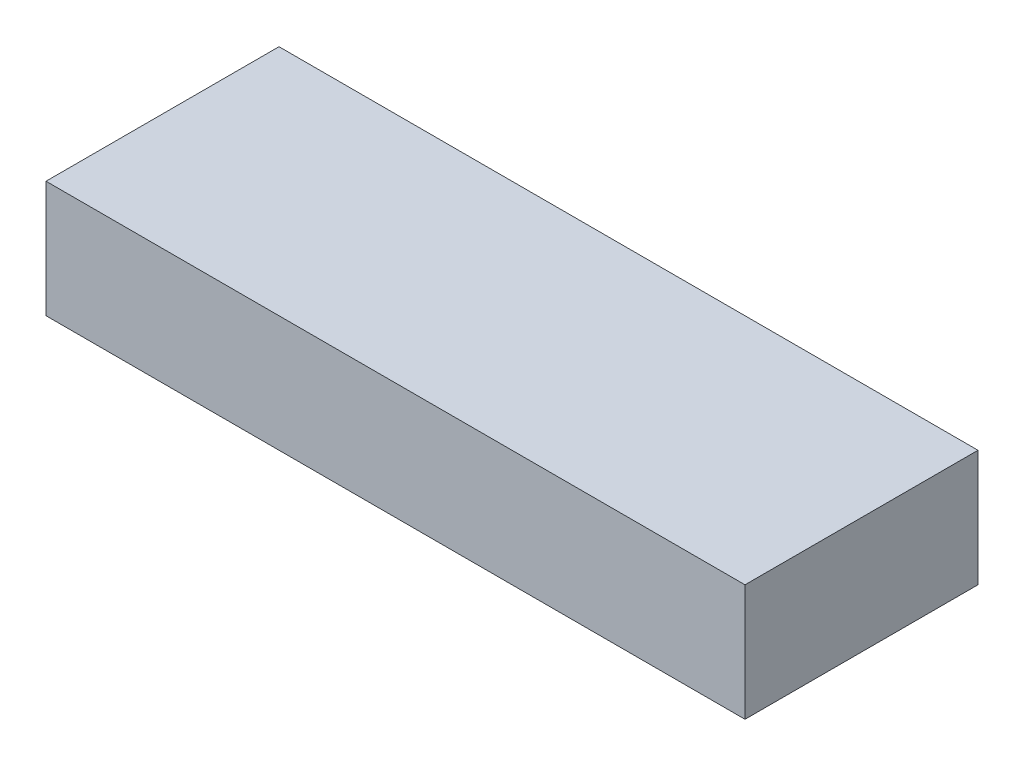
from build123d import *

# Parameters (mm, degrees)
SKETCH1_W           = 38.1
SKETCH1_H           = 12.7
BOSS_EXTRUDE1_DEPTH = 6.35
BOSS_EXTRUDE2_START = -0.508
BOSS_EXTRUDE2_DEPTH = 0.508


# Read off the part's stored shape, not the designer's step: Boss-Extrude2
with BuildPart() as part:
    # Sketch1 → Boss-Extrude1 (new body)
    with BuildSketch(Plane(origin=(0, 0, 0), x_dir=(1, 0, 0), z_dir=(0, 1, 0))):
        Rectangle(SKETCH1_W, SKETCH1_H)
    extrude(amount=BOSS_EXTRUDE1_DEPTH)


with BuildPart() as body_2:
    # Boss-Extrude2 outline → Boss-Extrude2 (new body)
    with BuildSketch(Plane(origin=(0, 6.35, 0), x_dir=(1, 0, 0), z_dir=(0, 1, 0)).offset(BOSS_EXTRUDE2_START)):
        with BuildLine():
            add(Edge.make_bspline(
                [(-1.911312881, -3.328169001), (-1.914155064, -3.327814447), (-1.924894218, -3.326474765), (-1.948199317, -3.318597457), (-1.988318743, -3.311811233), (-2.020185877, -3.304508432), (-2.038749808, -3.300254246)],
                knots=[0, 0, 0, 0, 0.065761094, 0.248477555, 0.56220691, 1, 1, 1, 1], degree=3))
            Line((-1.911312881, -3.328169001), (-1.930731842, -3.442255393))
            Line((-1.930731842, -3.442255393), (-1.310538799, -3.442255393))
            add(Edge.make_bspline(
                [(-0.59203727, -3.407058527), (-0.600059544, -3.410149267), (-0.621899223, -3.418563435), (-0.666035058, -3.42358605), (-0.728209595, -3.43001628), (-0.808862776, -3.434231568), (-0.907965619, -3.437983867), (-1.025326217, -3.439758583), (-1.161644788, -3.443026953), (-1.258752091, -3.442523748), (-1.310538799, -3.442255393)],
                knots=[0, 0, 0, 0, 0.035664115, 0.097091268, 0.183340579, 0.296308639, 0.432732696, 0.596027477, 0.784564016, 1, 1, 1, 1], degree=3))
            add(Edge.make_bspline(
                [(-0.448822438, -3.305108986), (-0.465709, -3.31779737), (-0.496058255, -3.340601478), (-0.537724756, -3.369001585), (-0.567635137, -3.391655766), (-0.585107586, -3.402684473), (-0.59203727, -3.407058527)],
                knots=[0, 0, 0, 0, 0.360325825, 0.64759305, 0.860233186, 1, 1, 1, 1], degree=3))
            Line((-0.448822438, -3.305108986), (-0.044665328, -2.966490867))
            add(Edge.make_bspline(
                [(0.198071675, -2.727394919), (0.195721894, -2.731094664), (0.188753582, -2.742066313), (0.171190379, -2.7604242), (0.145511219, -2.787672442), (0.098723157, -2.834004555), (0.034862288, -2.895193278), (-0.018645181, -2.943163452), (-0.044665328, -2.966490867)],
                knots=[0, 0, 0, 0, 0.03847759, 0.114105856, 0.222295526, 0.368186332, 0.692755341, 1, 1, 1, 1], degree=3))
            Line((0.198071675, -2.727394919), (0.256328556, -2.637582228))
            Line((0.256328556, -2.637582228), (0.409252868, -2.419118925))
            add(Edge.make_bspline(
                [(0.459013953, -2.347511509), (0.452539489, -2.3568154), (0.435936814, -2.380673664), (0.419363293, -2.404552191), (0.409252868, -2.419118925)],
                knots=[0, 0, 0, 0, 0.389965147, 1, 1, 1, 1], degree=3))
            add(Edge.make_bspline(
                [(0.490569764, -2.284399888), (0.483068252, -2.295424502), (0.469696827, -2.315075845), (0.462272954, -2.337616432), (0.459013953, -2.347511509)],
                knots=[0, 0, 0, 0, 0.561010681, 1, 1, 1, 1], degree=3))
            add(Edge.make_bspline(
                [(0.57188666, -2.170313497), (0.563509781, -2.184150666), (0.548330787, -2.209223763), (0.526335588, -2.241865687), (0.508796777, -2.267219999), (0.49599476, -2.279286553), (0.490569764, -2.284399888)],
                knots=[0, 0, 0, 0, 0.345107442, 0.625338361, 0.841233008, 1, 1, 1, 1], degree=3))
            Line((0.57188666, -2.170313497), (0.659271981, -2.01132076))
            Line((0.659271981, -2.01132076), (0.823119458, -1.737027946))
            add(Edge.make_bspline(
                [(1.031873281, -1.807421677), (1.01277457, -1.802431867), (0.974726312, -1.792491218), (0.92043813, -1.773220994), (0.868490137, -1.75865184), (0.837532496, -1.743897273), (0.823119458, -1.737027946)],
                knots=[0, 0, 0, 0, 0.268283473, 0.534471612, 0.783262603, 1, 1, 1, 1], degree=3))
            add(Edge.make_bspline(
                [(1.649638953, -2.069577641), (1.63816085, -2.059523639), (1.611620834, -2.036276473), (1.559607188, -2.006170611), (1.493202259, -1.97181656), (1.382521809, -1.921689428), (1.227461473, -1.863838963), (1.09767695, -1.826402703), (1.031873281, -1.807421677)],
                knots=[0, 0, 0, 0, 0.06765367, 0.15643085, 0.265752781, 0.400065773, 0.695819866, 1, 1, 1, 1], degree=3))
            add(Edge.make_bspline(
                [(1.921504397, -2.195800882), (1.907319474, -2.19560297), (1.882129047, -2.195251507), (1.849182319, -2.192205811), (1.824748032, -2.186116348), (1.80679678, -2.171816972), (1.788630835, -2.153832321), (1.761922538, -2.149685403), (1.736008486, -2.142356052), (1.711406439, -2.125409212), (1.682081183, -2.100386325), (1.661273449, -2.080626311), (1.649638953, -2.069577641)],
                knots=[0, 0, 0, 0, 0.136862362, 0.243048293, 0.320929747, 0.374094605, 0.463228005, 0.560946958, 0.626469684, 0.723008888, 0.845122395, 1, 1, 1, 1], degree=3))
            add(Edge.make_bspline(
                [(3.626731843, -2.4373242), (3.570062739, -2.437137336), (3.468806273, -2.436803446), (3.334591666, -2.428436853), (3.233087692, -2.421636221), (3.158089932, -2.404384401), (3.094458397, -2.388501867), (3.029415775, -2.379317427), (2.960795423, -2.374560054), (2.889256774, -2.367655962), (2.811414755, -2.362232215), (2.726769792, -2.352827801), (2.640958041, -2.340167304), (2.560606237, -2.324989881), (2.487107527, -2.310155223), (2.419822436, -2.296478725), (2.361040944, -2.287814204), (2.310262732, -2.284568576), (2.261070832, -2.28051317), (2.208496278, -2.265712742), (2.151758744, -2.249454392), (2.095316059, -2.233265627), (2.041800378, -2.22103277), (1.994713415, -2.206941695), (1.955013876, -2.197835662), (1.931241608, -2.19639215), (1.921504397, -2.195800882)],
                knots=[0, 0, 0, 0, 0.098367376, 0.17576302, 0.233645837, 0.274569138, 0.309165833, 0.347517732, 0.388416904, 0.428616166, 0.47231583, 0.523909207, 0.576469332, 0.622906931, 0.665894873, 0.706679237, 0.742149438, 0.768929498, 0.7950754, 0.827621098, 0.863423711, 0.897683498, 0.929547174, 0.958692517, 0.983080297, 1, 1, 1, 1], degree=3))
            Line((3.626731843, -2.4373242), (4.060017394, -2.4373242))
            Line((4.060017394, -2.4373242), (4.272412271, -2.223715638))
            Line((4.272412271, -2.223715638), (4.272412271, -1.337725576))
            add(Edge.make_bspline(
                [(4.16318062, -0.343717549), (4.177088549, -0.346689906), (4.207437154, -0.353175911), (4.236777515, -0.401930883), (4.255905523, -0.468523138), (4.261369272, -0.54230439), (4.264011605, -0.615955353), (4.266895117, -0.685557951), (4.267171352, -0.766903027), (4.270488971, -0.859111195), (4.271504958, -0.963099525), (4.270739513, -1.078000547), (4.272889999, -1.204216151), (4.272575854, -1.292009378), (4.272412271, -1.337725576)],
                knots=[0, 0, 0, 0, 0.039669652, 0.086563474, 0.152933145, 0.242523667, 0.298845081, 0.366881537, 0.444265225, 0.534566279, 0.634222548, 0.745595376, 0.867524951, 1, 1, 1, 1], degree=3))
            add(Edge.make_bspline(
                [(4.130411125, -0.270896448), (4.137782086, -0.283673696), (4.150195523, -0.305191863), (4.155759264, -0.323923536), (4.169296809, -0.344202528), (4.164087607, -0.343789468), (4.16318062, -0.343717549)],
                knots=[0, 0, 0, 0, 0.494572505, 0.832909654, 0.9709075, 1, 1, 1, 1], degree=3))
            add(Edge.make_bspline(
                [(3.527209672, 0.243705999), (3.551817089, 0.232587381), (3.606331831, 0.207955434), (3.687786694, 0.152666893), (3.779272276, 0.082099823), (3.873158975, -0.002930521), (3.961604995, -0.088534544), (4.036584412, -0.162854171), (4.091558242, -0.221040641), (4.119260216, -0.256587663), (4.130411125, -0.270896448)],
                knots=[0, 0, 0, 0, 0.101269179, 0.224349558, 0.368425874, 0.535259843, 0.699695807, 0.830789481, 0.931887492, 1, 1, 1, 1], degree=3))
            add(Edge.make_bspline(
                [(3.249275804, 0.457314561), (3.261134367, 0.451042325), (3.282175669, 0.439913152), (3.317334875, 0.437592939), (3.35497001, 0.427197516), (3.392845097, 0.396717742), (3.43153778, 0.357760907), (3.471407554, 0.323230098), (3.499684876, 0.284448954), (3.5199252, 0.269487063), (3.522563438, 0.238616895), (3.526794548, 0.243251305), (3.527209672, 0.243705999)],
                knots=[0, 0, 0, 0, 0.10875251, 0.19296557, 0.286632661, 0.425060799, 0.585065268, 0.737962698, 0.865318115, 0.952055214, 0.99529602, 1, 1, 1, 1], degree=3))
            add(Edge.make_bspline(
                [(2.841477638, 0.587178858), (2.880064956, 0.579319223), (2.954285236, 0.564201708), (3.059902785, 0.531897857), (3.156592421, 0.494655137), (3.218964543, 0.469526459), (3.249275804, 0.457314561)],
                knots=[0, 0, 0, 0, 0.275341564, 0.529602184, 0.771398654, 1, 1, 1, 1], degree=3))
            add(Edge.make_bspline(
                [(2.739528097, 0.616307298), (2.758367192, 0.609202194), (2.791570262, 0.596679762), (2.826406946, 0.590047877), (2.841477638, 0.587178858)],
                knots=[0, 0, 0, 0, 0.567390138, 1, 1, 1, 1], degree=3))
            Line((2.739528097, 0.616307298), (2.471303709, 0.697624194))
            add(Edge.make_bspline(
                [(2.115212588, 0.829323945), (2.13635194, 0.822367474), (2.177602522, 0.806019847), (2.235559824, 0.78088922), (2.286193493, 0.755275005), (2.329386016, 0.737702159), (2.362844397, 0.724917796), (2.391998137, 0.717783135), (2.426828458, 0.709070251), (2.453912689, 0.70209991), (2.471303709, 0.697624194)],
                knots=[0.289278138, 0.289278138, 0.289278138, 0.289278138, 0.413859299, 0.537651587, 0.643071538, 0.731452513, 0.798830854, 0.843354204, 0.899416372, 1, 1, 1, 1], degree=3))
            add(Edge.make_bspline(
                [(2.95313666, 1.303253017), (2.917534795, 1.274396738), (2.843213138, 1.214157017), (2.743219998, 1.147307234), (2.661098889, 1.097808701), (2.604242512, 1.067774598), (2.554073543, 1.043347391), (2.505292595, 1.027328104), (2.452660527, 1.01020161), (2.393175638, 0.980443687), (2.319252223, 0.946283465), (2.23985593, 0.901889189), (2.170246083, 0.86217136), (2.129052141, 0.837752418), (2.115212588, 0.829323945)],
                knots=[0, 0, 0, 0, 0.126305349, 0.263672219, 0.33120238, 0.390585186, 0.440991932, 0.484737994, 0.532011081, 0.59340289, 0.667739231, 0.756586152, 0.844028485, 0.88870161, 0.88870161, 0.88870161, 0.88870161], degree=3))
            add(Edge.make_bspline(
                [(3.073291476, 1.403988873), (3.076948048, 1.405779475), (3.082689185, 1.408590878), (3.07549389, 1.399037508), (3.064165088, 1.393079567), (3.03708793, 1.370244226), (2.998448721, 1.342261056), (2.968000873, 1.316049252), (2.95313666, 1.303253017)],
                knots=[0, 0, 0, 0, 0.044662039, 0.070123319, 0.150638955, 0.301765688, 0.659131779, 1, 1, 1, 1], degree=3))
            add(Edge.make_bspline(
                [(3.300250574, 1.53385317), (3.284842994, 1.525009533), (3.249756948, 1.504870859), (3.194282887, 1.471122443), (3.135290479, 1.43437456), (3.093287725, 1.413789027), (3.073291476, 1.403988873)],
                knots=[0, 0, 0, 0, 0.203718473, 0.463906448, 0.744781966, 1, 1, 1, 1], degree=3))
            add(Edge.make_bspline(
                [(3.458029626, 1.646725876), (3.444738944, 1.635323666), (3.418115073, 1.612482779), (3.377823469, 1.580148263), (3.338974524, 1.552730619), (3.312139118, 1.539648689), (3.300250574, 1.53385317)],
                knots=[0, 0, 0, 0, 0.269825528, 0.540514039, 0.796439856, 1, 1, 1, 1], degree=3))
            Line((3.458029626, 1.646725876), (3.570902333, 1.771735433))
            Line((3.570902333, 1.771735433), (3.553910742, 3.075233139))
            Line((3.553910742, 3.075233139), (3.238352638, 3.459971289))
            Line((3.238352638, 3.459971289), (2.790502868, 3.459971289))
            add(Edge.make_bspline(
                [(1.949419152, 3.275491167), (1.984666064, 3.295620323), (2.053617776, 3.33499795), (2.155963334, 3.378760836), (2.243568784, 3.40795895), (2.308023733, 3.420931189), (2.352638363, 3.416906567), (2.373428221, 3.433212314), (2.392368102, 3.4428774), (2.418912268, 3.447948413), (2.458715266, 3.450457883), (2.533112046, 3.456205308), (2.645264586, 3.45753863), (2.739531928, 3.459117555), (2.790502868, 3.459971289)],
                knots=[0, 0, 0, 0, 0.138763343, 0.271455555, 0.380465421, 0.453296707, 0.497789032, 0.525091993, 0.540569105, 0.57045236, 0.616323139, 0.677374414, 0.825554332, 1, 1, 1, 1], degree=3))
            add(Edge.make_bspline(
                [(1.586527333, 3.16261846), (1.599033474, 3.166778733), (1.627837942, 3.176360781), (1.674016741, 3.188559505), (1.723116745, 3.199024553), (1.77073082, 3.207202863), (1.818031771, 3.217003588), (1.864929902, 3.231292267), (1.911802345, 3.24712073), (1.937249658, 3.266312985), (1.949419152, 3.275491167)],
                knots=[0, 0, 0, 0, 0.103246554, 0.237800136, 0.373949638, 0.496424731, 0.616413602, 0.751823156, 0.881316081, 1, 1, 1, 1], degree=3))
            add(Edge.make_bspline(
                [(0.99546273, 2.916240402), (1.005587447, 2.91985254), (1.031990574, 2.929272233), (1.079583514, 2.947465208), (1.144734557, 2.971466892), (1.253317558, 3.016214392), (1.404108952, 3.077100841), (1.524882415, 3.133719363), (1.586527333, 3.16261846)],
                knots=[0, 0, 0, 0, 0.050341158, 0.131279125, 0.238605315, 0.375464167, 0.681225833, 1, 1, 1, 1], degree=3))
            add(Edge.make_bspline(
                [(0.341286507, 2.296047359), (0.396538032, 2.359691727), (0.512384871, 2.493135987), (0.666253254, 2.650678589), (0.789691114, 2.769974976), (0.870593624, 2.838247248), (0.935302773, 2.889398069), (0.977726688, 2.908326887), (0.99546273, 2.916240402)],
                knots=[0, 0, 0, 0, 0.278951005, 0.584881458, 0.72888132, 0.846695488, 0.935908432, 1, 1, 1, 1], degree=3))
            add(Edge.make_bspline(
                [(-0.384497132, 1.51928895), (-0.379988453, 1.52286373), (-0.368073977, 1.532310321), (-0.34852128, 1.552130224), (-0.320042395, 1.57655776), (-0.287265437, 1.610997437), (-0.246112975, 1.650763339), (-0.20064439, 1.700331559), (-0.146201514, 1.754747607), (-0.067830406, 1.836988803), (0.03146761, 1.940901163), (0.142081909, 2.065225209), (0.246475496, 2.181152089), (0.310391167, 2.258607315), (0.341286507, 2.296047359)],
                knots=[0, 0, 0, 0, 0.016215303, 0.042849993, 0.07838327, 0.121947311, 0.176805733, 0.239752252, 0.311556778, 0.393860228, 0.560119453, 0.716835089, 0.863124708, 1, 1, 1, 1], degree=3))
            add(Edge.make_bspline(
                [(-0.503438264, 1.445254164), (-0.484162837, 1.460706947), (-0.447448725, 1.490140028), (-0.404769271, 1.509902198), (-0.384497132, 1.51928895)],
                knots=[0, 0, 0, 0, 0.525014108, 1, 1, 1, 1], degree=3))
            add(Edge.make_bspline(
                [(-0.553199349, 1.461032069), (-0.543865203, 1.458836954), (-0.531367738, 1.45589792), (-0.505376406, 1.436023527), (-0.506060575, 1.44279016), (-0.504589739, 1.444172203), (-0.503438264, 1.445254164)],
                knots=[0, 0, 0, 0, 0.673938468, 0.902334499, 0.923540538, 1, 1, 1, 1], degree=3))
            Line((-0.553199349, 1.461032069), (-0.641798355, 1.492587879))
            add(Edge.make_bspline(
                [(-0.656362576, 1.510793155), (-0.644253461, 1.503812754), (-0.63027809, 1.495756533), (-0.640441186, 1.492961169), (-0.641798355, 1.492587879)],
                knots=[0, 0, 0, 0, 0.866461039, 1, 1, 1, 1], degree=3))
            add(Edge.make_bspline(
                [(-1.764456995, 2.066660892), (-1.738118681, 2.064646247), (-1.688032691, 2.060815119), (-1.617639541, 2.049031032), (-1.55639572, 2.031867525), (-1.48349118, 2.003845634), (-1.397405913, 1.946470311), (-1.317161177, 1.876191643), (-1.252842852, 1.815337826), (-1.205824887, 1.779097416), (-1.162723389, 1.751722929), (-1.119432688, 1.736141441), (-1.073522827, 1.720971118), (-1.019992944, 1.700546141), (-0.957599904, 1.670515455), (-0.887639183, 1.637294271), (-0.818253478, 1.601234473), (-0.755512699, 1.56697936), (-0.701811373, 1.538666347), (-0.67044245, 1.51942817), (-0.656362576, 1.510793155)],
                knots=[0, 0, 0, 0, 0.062936398, 0.119682372, 0.169744125, 0.214325141, 0.305283186, 0.414044642, 0.468653525, 0.516093397, 0.555446919, 0.589643795, 0.625317469, 0.670796491, 0.726014792, 0.79026677, 0.855381036, 0.91232325, 0.960646477, 1, 1, 1, 1], degree=3))
            add(Edge.make_bspline(
                [(-2.056955083, 2.200166243), (-2.039527383, 2.190190459), (-2.006375593, 2.171214055), (-1.953332647, 2.16080259), (-1.902252205, 2.149148075), (-1.864945248, 2.11277444), (-1.82195887, 2.077341832), (-1.784212733, 2.070330508), (-1.764456995, 2.066660892)],
                knots=[0, 0, 0, 0, 0.183139778, 0.348377086, 0.496731424, 0.653135243, 0.818456408, 1, 1, 1, 1], degree=3))
            add(Edge.make_bspline(
                [(-2.313042622, 2.275414714), (-2.285393543, 2.271658256), (-2.233594482, 2.264620734), (-2.163262029, 2.244581538), (-2.105455102, 2.223237511), (-2.071837025, 2.207245524), (-2.056955083, 2.200166243)],
                knots=[0, 0, 0, 0, 0.311645643, 0.583851356, 0.815780663, 1, 1, 1, 1], degree=3))
            Line((-2.313042622, 2.275414714), (-2.320324732, 2.279055769))
            Line((-2.320324732, 2.279055769), (-2.320324732, 4.029189561))
            Line((-2.320324732, 4.029189561), (-2.428342698, 4.145703323))
            add(Edge.make_bspline(
                [(-2.707490251, 4.222165479), (-2.675129995, 4.224138856), (-2.619605131, 4.227524847), (-2.543582916, 4.213200143), (-2.485410095, 4.179670319), (-2.448105801, 4.157466488), (-2.428342698, 4.145703323)],
                knots=[0, 0, 0, 0, 0.326885392, 0.560881439, 0.767363367, 1, 1, 1, 1], degree=3))
            add(Edge.make_bspline(
                [(-3.098296826, 3.878692619), (-3.088044288, 3.906091365), (-3.068582582, 3.958100568), (-3.030141327, 4.028389612), (-2.987905524, 4.087978896), (-2.941486992, 4.138359018), (-2.888934928, 4.175592652), (-2.832722368, 4.20378011), (-2.771472375, 4.219674903), (-2.729018576, 4.221327464), (-2.707490251, 4.222165479)],
                knots=[0, 0, 0, 0, 0.156890454, 0.297814638, 0.428599772, 0.548430116, 0.663562538, 0.772353999, 0.884560694, 1, 1, 1, 1], degree=3))
            add(Edge.make_bspline(
                [(-3.285204319, 3.472108139), (-3.269301993, 3.494438685), (-3.232693553, 3.54584541), (-3.186005262, 3.639512969), (-3.136957495, 3.751907114), (-3.111594051, 3.835085113), (-3.098296826, 3.878692619)],
                knots=[0, 0, 0, 0, 0.182645397, 0.420464492, 0.696168468, 1, 1, 1, 1], degree=3))
            add(Edge.make_bspline(
                [(-3.366521215, 3.061882604), (-3.364935831, 3.09263382), (-3.362014631, 3.149295463), (-3.357545786, 3.227001923), (-3.351871994, 3.290304192), (-3.342565143, 3.352081577), (-3.328893186, 3.416214995), (-3.299188201, 3.454217926), (-3.285204319, 3.472108139)],
                knots=[0, 0, 0, 0, 0.216978474, 0.399800672, 0.5487382, 0.664055382, 0.84185112, 1, 1, 1, 1], degree=3))
            add(Edge.make_bspline(
                [(-3.538864487, 2.490236962), (-3.521570655, 2.51634808), (-3.489558481, 2.564681707), (-3.449373387, 2.634526089), (-3.418021936, 2.694209896), (-3.39795855, 2.750223972), (-3.385297884, 2.808945804), (-3.377916089, 2.879319389), (-3.370241892, 2.96506314), (-3.367827958, 3.027878537), (-3.366521215, 3.061882604)],
                knots=[0, 0, 0, 0, 0.153968548, 0.285007264, 0.39622649, 0.484956851, 0.576670574, 0.690926881, 0.832688427, 1, 1, 1, 1], degree=3))
            add(Edge.make_bspline(
                [(-3.678438264, 2.211089408), (-3.672943017, 2.231123834), (-3.660204788, 2.277564538), (-3.624962205, 2.346582765), (-3.582282269, 2.418522021), (-3.553061036, 2.466787936), (-3.538864487, 2.490236962)],
                knots=[0, 0, 0, 0, 0.198450577, 0.460017394, 0.73766029, 1, 1, 1, 1], degree=3))
            Line((-3.678438264, 2.211089408), (-3.707566704, 2.128558827))
            add(Edge.make_bspline(
                [(-3.726985664, 2.073943002), (-3.724992529, 2.08002181), (-3.718971485, 2.098385226), (-3.712138068, 2.116464382), (-3.707566704, 2.128558827)],
                knots=[0, 0, 0, 0, 0.331028175, 1, 1, 1, 1], degree=3))
            add(Edge.make_bspline(
                [(-3.75975516, 1.94286502), (-3.75857636, 1.96716122), (-3.756347511, 2.013099928), (-3.736388632, 2.054458347), (-3.726985664, 2.073943002)],
                knots=[0, 0, 0, 0, 0.528882981, 1, 1, 1, 1], degree=3))
            add(Edge.make_bspline(
                [(-3.853208906, 1.686777482), (-3.838858538, 1.709510348), (-3.81173122, 1.752483581), (-3.782240417, 1.818556879), (-3.763857655, 1.881600051), (-3.76108985, 1.922933313), (-3.75975516, 1.94286502)],
                knots=[0, 0, 0, 0, 0.291603169, 0.551234081, 0.783596301, 1, 1, 1, 1], degree=3))
            Line((-3.853208906, 1.686777482), (-3.950303707, 1.53385317))
            add(Edge.make_bspline(
                [(-4.018270068, 1.396706763), (-4.006274941, 1.421859991), (-3.984310375, 1.467918672), (-3.960920208, 1.513269157), (-3.950303707, 1.53385317)],
                knots=[0, 0, 0, 0, 0.546112628, 1, 1, 1, 1], degree=3))
            Line((-4.018270068, 1.396706763), (-4.088663799, 1.246209821))
            add(Edge.make_bspline(
                [(-4.194254395, 0.780154775), (-4.190732873, 0.830040374), (-4.184201548, 0.922562603), (-4.161650308, 1.050242001), (-4.134650503, 1.158310753), (-4.103052287, 1.21870764), (-4.088663799, 1.246209821)],
                knots=[0, 0, 0, 0, 0.311056557, 0.576912905, 0.807344074, 1, 1, 1, 1], degree=3))
            add(Edge.make_bspline(
                [(-3.332538034, 0.320168155), (-3.360385506, 0.334925257), (-3.409861043, 0.361143635), (-3.47677429, 0.381895744), (-3.532713829, 0.387581711), (-3.588147545, 0.391504568), (-3.659029695, 0.391617214), (-3.740739571, 0.392999932), (-3.822859885, 0.394367421), (-3.895346281, 0.394455203), (-3.952823507, 0.39856821), (-4.008648846, 0.403328032), (-4.069226343, 0.423361417), (-4.121576281, 0.475201548), (-4.162357309, 0.531454686), (-4.186294189, 0.582297124), (-4.194049236, 0.627011643), (-4.197555074, 0.669222188), (-4.196899736, 0.721529264), (-4.195185038, 0.75953007), (-4.194254395, 0.780154775)],
                knots=[0, 0, 0, 0, 0.082358369, 0.146322962, 0.181502971, 0.229232844, 0.291682376, 0.366830169, 0.443036172, 0.506543869, 0.556385883, 0.593668011, 0.653254039, 0.718467178, 0.782194945, 0.835279738, 0.863300104, 0.900476937, 0.945984467, 1, 1, 1, 1], degree=3))
            add(Edge.make_bspline(
                [(-3.046108371, 0.202440708), (-3.067670693, 0.209401567), (-3.114628717, 0.224560797), (-3.185652684, 0.255533849), (-3.26044786, 0.285740226), (-3.309175709, 0.309011066), (-3.332538034, 0.320168155)],
                knots=[0, 0, 0, 0, 0.219213771, 0.477399656, 0.749441865, 1, 1, 1, 1], degree=3))
            add(Edge.make_bspline(
                [(-2.498736429, -0.06821105), (-2.512292474, -0.057016903), (-2.542302283, -0.032235765), (-2.596748423, 0.002143388), (-2.661986733, 0.041178705), (-2.762704736, 0.09406878), (-2.890245574, 0.153659826), (-2.996370073, 0.186873952), (-3.046108371, 0.202440708)],
                knots=[0, 0, 0, 0, 0.085809207, 0.189960855, 0.314019296, 0.457251465, 0.745625291, 1, 1, 1, 1], degree=3))
            add(Edge.make_bspline(
                [(-1.759602255, -0.563394537), (-1.77303643, -0.555023723), (-1.806673023, -0.534064813), (-1.861392802, -0.494284828), (-1.925458855, -0.446435935), (-1.990156599, -0.38972108), (-2.059061416, -0.33134563), (-2.135677151, -0.278742489), (-2.209463279, -0.230141309), (-2.279555023, -0.192229715), (-2.345904486, -0.16092646), (-2.405823474, -0.126095224), (-2.459731523, -0.099179939), (-2.487622959, -0.077034858), (-2.498736429, -0.06821105)],
                knots=[0, 0, 0, 0, 0.053201765, 0.133206994, 0.227331506, 0.321897207, 0.422381247, 0.530688914, 0.634067719, 0.7192796, 0.798354504, 0.880527052, 0.952395461, 1, 1, 1, 1], degree=3))
            Line((-1.759602255, -0.563394537), (-1.59822533, -0.633996941))
            add(Edge.make_bspline(
                [(-1.687994839, -0.834046295), (-1.679174849, -0.823199517), (-1.659668022, -0.799210121), (-1.654870296, -0.747420279), (-1.639384223, -0.68835631), (-1.612924295, -0.652892481), (-1.59822533, -0.633996941)],
                knots=[0, 0, 0, 0, 0.178340076, 0.394427783, 0.657949377, 0.965873907, 0.965873907, 0.965873907, 0.965873907], degree=3))
            add(Edge.make_bspline(
                [(-1.913740251, -1.155672824), (-1.903974773, -1.143579), (-1.882058814, -1.116437704), (-1.849597471, -1.073620746), (-1.817150033, -1.029493607), (-1.791513569, -0.985613895), (-1.767739616, -0.942248346), (-1.73982866, -0.902104184), (-1.713986662, -0.864589738), (-1.69582143, -0.843243459), (-1.687994839, -0.834046295)],
                knots=[0, 0, 0, 0, 0.118488971, 0.26591625, 0.409685038, 0.535569535, 0.653010267, 0.78645077, 0.907991118, 1, 1, 1, 1], degree=3))
            Line((-1.913740251, -1.155672824), (-2.031467698, -1.252767625))
            Line((-2.031467698, -1.252767625), (-2.031467698, -1.949422824))
            add(Edge.make_bspline(
                [(-2.055741398, -2.728608604), (-2.054520681, -2.715259237), (-2.051452103, -2.681702268), (-2.046188651, -2.621489029), (-2.043747313, -2.541268108), (-2.035608323, -2.40345766), (-2.033811593, -2.203886116), (-2.032280006, -2.037610517), (-2.031467698, -1.949422824)],
                knots=[0, 0, 0, 0, 0.051572699, 0.129640871, 0.232468735, 0.360244544, 0.660692499, 1, 1, 1, 1], degree=3))
            Line((-2.055741398, -2.728608604), (-2.071519303, -2.882746601))
            Line((-2.071519303, -2.882746601), (-2.087297209, -3.044166708))
            add(Edge.make_bspline(
                [(-2.038749808, -3.300254246), (-2.049614524, -3.296542893), (-2.076119234, -3.287488968), (-2.084539004, -3.245288537), (-2.091085816, -3.204864681), (-2.090729941, -3.159747462), (-2.091770458, -3.105241859), (-2.088868038, -3.065613896), (-2.087297209, -3.044166708)],
                knots=[0, 0, 0, 0, 0.117254845, 0.286045717, 0.409643176, 0.571385928, 0.768028281, 1, 1, 1, 1], degree=3))
        make_face()
        with BuildLine():
            add(Edge.make_bspline(
                [(-1.231649273, -2.933721371), (-1.194024678, -2.933689597), (-1.126462232, -2.933632538), (-1.036245153, -2.933966811), (-0.969069344, -2.933141935), (-0.907117769, -2.929974451), (-0.865965463, -2.933941473), (-0.840093073, -2.939212671), (-0.838508136, -2.939545778)],
                knots=[0, 0, 0, 0, 0.231000119, 0.414806665, 0.553925686, 0.643379579, 0.795626967, 0.805577829, 0.805577829, 0.805577829, 0.805577829], degree=3))
            Line((-1.231649273, -2.933721371), (-1.463463111, -2.732249659))
            Line((-1.463463111, -2.732249659), (-1.454967316, -2.209151417))
            Line((-1.454967316, -2.209151417), (-1.439189411, -1.474871983))
            Line((-1.439189411, -1.474871983), (-1.39306938, -1.421469842))
            add(Edge.make_bspline(
                [(-1.203734518, -1.139894919), (-1.217800868, -1.165428272), (-1.243683137, -1.212409975), (-1.283707731, -1.281800097), (-1.333522535, -1.34989683), (-1.371732913, -1.395824231), (-1.39306938, -1.421469842)],
                knots=[0, 0, 0, 0, 0.257128303, 0.473119424, 0.705792753, 1, 1, 1, 1], degree=3))
            Line((-1.203734518, -1.139894919), (-1.180674502, -1.082851723))
            add(Edge.make_bspline(
                [(-1.146691322, -1.030663267), (-1.151861714, -1.039216852), (-1.162606296, -1.056992038), (-1.174502738, -1.074018535), (-1.180674502, -1.082851723)],
                knots=[0, 0, 0, 0, 0.481209283, 1, 1, 1, 1], degree=3))
            Line((-1.146691322, -1.030663267), (-0.765594227, -1.080424353))
            Line((-0.765594227, -1.080424353), (-0.662431001, -1.122903329))
            add(Edge.make_bspline(
                [(-0.096853784, -1.381418237), (-0.124942446, -1.372158295), (-0.184382775, -1.352562701), (-0.270072178, -1.314095322), (-0.350222254, -1.278391192), (-0.414212544, -1.240977502), (-0.46469424, -1.206755204), (-0.510500589, -1.17921304), (-0.551079094, -1.15988592), (-0.585645293, -1.144956266), (-0.622435721, -1.13696666), (-0.647575175, -1.128127005), (-0.662431001, -1.122903329)],
                knots=[0, 0, 0, 0, 0.142011202, 0.30051956, 0.450955346, 0.563315478, 0.656053991, 0.744067824, 0.819705284, 0.872046404, 0.924387523, 1, 1, 1, 1], degree=3))
            add(Edge.make_bspline(
                [(0.283801105, -1.489534845), (0.283543754, -1.489503015), (0.274221266, -1.488311687), (0.253527902, -1.482329131), (0.217883948, -1.474156583), (0.172666146, -1.463532786), (0.118637043, -1.447410227), (0.055374132, -1.427576936), (-0.017692462, -1.406126645), (-0.069368995, -1.389996989), (-0.096853784, -1.381418237)],
                knots=[0.158169211, 0.158169211, 0.158169211, 0.158169211, 0.159821064, 0.218050206, 0.295047686, 0.393327767, 0.514220395, 0.654639875, 0.816316042, 1, 1, 1, 1], degree=3))
            add(Edge.make_bspline(
                [(0.230841171, -1.59259943), (0.235867648, -1.585144634), (0.246838008, -1.568874437), (0.251513665, -1.535394568), (0.266599426, -1.508352008), (0.279664687, -1.493730662), (0.283801105, -1.489534845)],
                knots=[0, 0, 0, 0, 0.162636243, 0.354955938, 0.606823785, 0.714979068, 0.714979068, 0.714979068, 0.714979068], degree=3))
            add(Edge.make_bspline(
                [(0.16530218, -1.686053176), (0.176434745, -1.667014666), (0.195720381, -1.63403307), (0.220405465, -1.604910921), (0.230841171, -1.59259943)],
                knots=[0, 0, 0, 0, 0.577246486, 1, 1, 1, 1], degree=3))
            Line((0.16530218, -1.686053176), (-0.043451643, -2.056227105))
            add(Edge.make_bspline(
                [(-0.318958141, -2.461597901), (-0.308730822, -2.439482698), (-0.292801076, -2.405036763), (-0.260885119, -2.365646547), (-0.224673064, -2.333350953), (-0.196569059, -2.290822654), (-0.163224238, -2.243017982), (-0.129110804, -2.191673744), (-0.08846619, -2.128025433), (-0.059192757, -2.081334227), (-0.043451643, -2.056227105)],
                knots=[0, 0, 0, 0, 0.148003685, 0.230525829, 0.30734712, 0.443149258, 0.539032915, 0.663668952, 0.819145724, 1, 1, 1, 1], degree=3))
            add(Edge.make_bspline(
                [(-0.740106842, -2.85604553), (-0.729471234, -2.842831525), (-0.703199337, -2.810190516), (-0.649800738, -2.76322833), (-0.584704184, -2.709186187), (-0.515196647, -2.652547469), (-0.445797705, -2.597580877), (-0.389283652, -2.542698889), (-0.345007558, -2.499738316), (-0.326000064, -2.471908376), (-0.318958141, -2.461597901)],
                knots=[0, 0, 0, 0, 0.087805737, 0.216896223, 0.36726433, 0.526772751, 0.681707452, 0.82561921, 0.935395162, 1, 1, 1, 1], degree=3))
            add(Edge.make_bspline(
                [(-0.838508136, -2.939545778), (-0.837673459, -2.938408978), (-0.828800475, -2.926445178), (-0.813463694, -2.907996679), (-0.794933951, -2.886267074), (-0.775311436, -2.876217243), (-0.75411271, -2.874414422), (-0.744832418, -2.86224319), (-0.740106842, -2.85604553)],
                knots=[0.263118756, 0.263118756, 0.263118756, 0.263118756, 0.286728282, 0.512536769, 0.665416059, 0.756062327, 0.875785577, 1, 1, 1, 1], degree=3))
        make_face(mode=Mode.SUBTRACT)
        with BuildLine():
            add(Edge.make_bspline(
                [(1.425107226, 0.967062268), (1.440207848, 0.964279193), (1.45530847, 0.961496118), (1.461397054, 0.949106395)],
                knots=[0, 0, 0, 0, 0.264807067, 0.264807067, 0.264807067, 0.264807067], degree=3))
            add(Edge.make_bspline(
                [(1.297670299, 0.973130693), (1.319906951, 0.9712051), (1.362309523, 0.96753323), (1.404867431, 0.96721406), (1.425107226, 0.967062268)],
                knots=[0, 0, 0, 0, 0.524417531, 1, 1, 1, 1], degree=3))
            Line((1.297670299, 0.973130693), (1.137463877, 0.981626488))
            add(Edge.make_bspline(
                [(0.711460437, 1.030173888), (0.743440409, 1.026733069), (0.799027635, 1.020752277), (0.874487346, 1.010135661), (0.938258864, 0.994254931), (1.002349407, 0.989261176), (1.068920577, 0.981443609), (1.114375547, 0.981564886), (1.137463877, 0.981626488)],
                knots=[0, 0, 0, 0, 0.224741161, 0.390642536, 0.531997877, 0.68276148, 0.838862339, 1, 1, 1, 1], degree=3))
            Line((0.711460437, 1.030173888), (0.526980314, 1.045951794))
            add(Edge.make_bspline(
                [(-0.016875828, 1.114587629), (-0.008393148, 1.112525192), (0.018293589, 1.106952166), (0.067355899, 1.098760081), (0.134293502, 1.086975164), (0.214682644, 1.078466857), (0.307614151, 1.066978694), (0.413244982, 1.056304323), (0.487731964, 1.049524296), (0.526980314, 1.045951794)],
                knots=[0.078794462, 0.078794462, 0.078794462, 0.078794462, 0.12277337, 0.215945107, 0.32955488, 0.465081967, 0.623116575, 0.801414253, 1, 1, 1, 1], degree=3))
            Line((-0.016875828, 1.114587629), (0.096122134, 1.212226641))
            add(Edge.make_bspline(
                [(0.95662481, 2.147977788), (0.95345823, 2.143072801), (0.944976598, 2.129934874), (0.926185496, 2.107248507), (0.899540455, 2.075661003), (0.864619075, 2.036105737), (0.821337642, 1.988324781), (0.771241584, 1.931291395), (0.710795043, 1.867414619), (0.578179086, 1.717925294), (0.370467295, 1.500249436), (0.185917607, 1.306498918), (0.096122134, 1.212226641)],
                knots=[0, 0, 0, 0, 0.013764326, 0.036867524, 0.069372683, 0.11130047, 0.161312394, 0.221468896, 0.29035667, 0.368744106, 0.692852794, 1, 1, 1, 1], degree=3))
            add(Edge.make_bspline(
                [(1.184797593, 2.427125341), (1.188937564, 2.426307244), (1.200015193, 2.424118202), (1.181331526, 2.400145716), (1.163256303, 2.376935022), (1.106271767, 2.32559866), (1.035061082, 2.252046396), (0.982772907, 2.182670871), (0.95662481, 2.147977788)],
                knots=[0, 0, 0, 0, 0.027609248, 0.073876113, 0.165730273, 0.309700736, 0.654797424, 1, 1, 1, 1], degree=3))
            add(Edge.make_bspline(
                [(1.41175669, 2.496305387), (1.392396348, 2.488450392), (1.35275323, 2.472366148), (1.293272597, 2.451792695), (1.237490942, 2.433446125), (1.201080218, 2.429078509), (1.184797593, 2.427125341)],
                knots=[0, 0, 0, 0, 0.263178583, 0.538896425, 0.793797661, 1, 1, 1, 1], degree=3))
            Line((1.41175669, 2.496305387), (1.514919917, 2.544852788))
            Line((1.514919917, 2.544852788), (1.78921273, 2.656511809))
            add(Edge.make_bspline(
                [(2.20307932, 2.786376106), (2.193593599, 2.779826084), (2.16587312, 2.760684712), (2.106520912, 2.748615293), (2.040707492, 2.730191961), (1.976210014, 2.714779944), (1.917266736, 2.702378688), (1.8640927, 2.684912714), (1.819919432, 2.672886344), (1.797212439, 2.660777702), (1.78921273, 2.656511809)],
                knots=[0, 0, 0, 0, 0.078848659, 0.23042238, 0.408812166, 0.552066834, 0.686546313, 0.823173018, 0.937703585, 1, 1, 1, 1], degree=3))
            add(Edge.make_bspline(
                [(2.772297593, 2.950223583), (2.710202776, 2.945557588), (2.59487426, 2.936891449), (2.43700101, 2.904590509), (2.304981366, 2.858760004), (2.235420934, 2.809349266), (2.20307932, 2.786376106)],
                knots=[0, 0, 0, 0, 0.310242538, 0.57621253, 0.802963118, 1, 1, 1, 1], degree=3))
            Line((2.772297593, 2.950223583), (2.932504015, 2.958719378))
            Line((2.932504015, 2.958719378), (2.954350345, 2.921095142))
            add(Edge.make_bspline(
                [(2.985906155, 2.422270601), (2.984736963, 2.469603807), (2.982628249, 2.554972262), (2.979217241, 2.669491207), (2.975315932, 2.756024952), (2.972905512, 2.817718959), (2.96648504, 2.859551434), (2.963973882, 2.888975908), (2.959325739, 2.90844704), (2.955616254, 2.917877035), (2.954350345, 2.921095142)],
                knots=[0, 0, 0, 0, 0.283582004, 0.511458223, 0.686064256, 0.802594298, 0.880733102, 0.939337204, 0.979298038, 1, 1, 1, 1], degree=3))
            Line((2.985906155, 2.422270601), (2.99440195, 1.987771366))
            Line((2.99440195, 1.987771366), (2.894879779, 1.9283008))
            Line((2.894879779, 1.9283008), (2.797784978, 1.871257604))
            add(Edge.make_bspline(
                [(2.684912271, 1.809359668), (2.702200212, 1.820031249), (2.728413397, 1.836212245), (2.759972841, 1.85391894), (2.781266679, 1.86176), (2.791810274, 1.867822301), (2.797784978, 1.871257604)],
                knots=[0, 0, 0, 0, 0.473195317, 0.717491837, 0.839912041, 1, 1, 1, 1], degree=3))
            Line((2.684912271, 1.809359668), (2.5853901, 1.725615402))
            add(Edge.make_bspline(
                [(2.103557149, 1.452536274), (2.124645209, 1.467262463), (2.162440349, 1.493655521), (2.229519794, 1.507394953), (2.303247219, 1.524079477), (2.387437662, 1.572015086), (2.486964984, 1.637586781), (2.551304564, 1.695130269), (2.5853901, 1.725615402)],
                knots=[0, 0, 0, 0, 0.135838687, 0.243457309, 0.362088148, 0.539200128, 0.755879494, 1, 1, 1, 1], degree=3))
            Line((2.103557149, 1.452536274), (2.011317088, 1.397920448))
            Line((2.011317088, 1.397920448), (1.845042241, 1.310535127))
            add(Edge.make_bspline(
                [(1.474868311, 1.004686503), (1.477096747, 1.015835072), (1.481901664, 1.039873435), (1.503709162, 1.074335289), (1.533713422, 1.110366997), (1.57581186, 1.147229519), (1.626898846, 1.18671682), (1.690292361, 1.226875915), (1.763620287, 1.268924533), (1.817000959, 1.296204662), (1.845042241, 1.310535127)],
                knots=[0, 0, 0, 0, 0.068550105, 0.147806625, 0.243780548, 0.353386899, 0.486599167, 0.635889439, 0.808729887, 1, 1, 1, 1], degree=3))
            add(Edge.make_bspline(
                [(1.461397054, 0.949106395), (1.464767399, 0.958603419), (1.470457869, 0.976818597), (1.473451446, 0.995733869), (1.474868311, 1.004686503)],
                knots=[0.343919232, 0.343919232, 0.343919232, 0.343919232, 0.689475743, 1, 1, 1, 1], degree=3))
        make_face(mode=Mode.SUBTRACT)
    extrude(amount=BOSS_EXTRUDE2_DEPTH)


solid = Compound([part.part, body_2.part])
